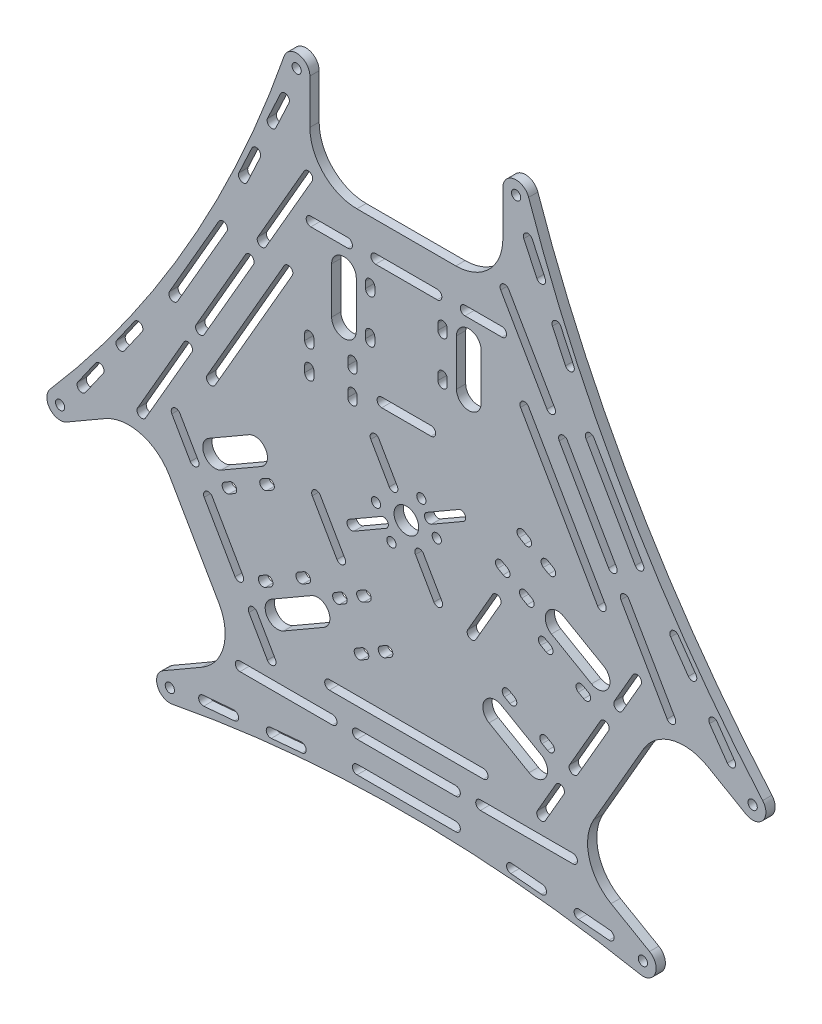
from build123d import *

# Parameters (mm, degrees)
SKETCH_1_R      = 1.5
SKETCH_1_R_2    = 4
EXTRUDE_1_DEPTH = 3


with BuildPart() as part:
    # 草图1 → 凸台-拉伸1 (new body)
    with BuildSketch(Plane.XY):
        with BuildLine():
            Line((16.05, 79.5), (-16.05, 79.5))
            ThreePointArc((-16.05, 79.5), (-26.833378413, 83.966621587), (-31.3, 94.75))
            Line((-31.3, 94.75), (-31.3, 109.16))
            ThreePointArc((-31.3, 109.16), (-34.888111661, 113.400662094), (-39.664286043, 110.564129253))
            ThreePointArc((-39.664286043, 110.564129253), (-71.327244812, 41.180803993), (-115.583487702, -20.93178529))
            ThreePointArc((-115.583487702, -20.93178529), (-115.651910009, -26.486340058), (-110.185333077, -27.473404862))
            Line((-110.185333077, -27.473404862), (-97.705907009, -20.268404862))
            ThreePointArc((-97.705907009, -20.268404862), (-86.133916571, -18.744923418), (-76.874019601, -25.850292269))
            Line((-76.874019601, -25.850292269), (-60.824019601, -53.649707731))
            ThreePointArc((-60.824019601, -53.649707731), (-59.300538158, -65.221698169), (-66.405907009, -74.481595138))
            Line((-66.405907009, -74.481595138), (-78.885333077, -81.686595138))
            ThreePointArc((-78.885333077, -81.686595138), (-80.763798349, -86.914322035), (-75.919201659, -89.632343963))
            ThreePointArc((-75.919201659, -89.632343963), (0, -82.361607985), (75.919201659, -89.632343963))
            ThreePointArc((75.919201659, -89.632343963), (80.763798349, -86.914322035), (78.885333077, -81.686595138))
            Line((78.885333077, -81.686595138), (66.405907009, -74.481595138))
            ThreePointArc((66.405907009, -74.481595138), (59.300538158, -65.221698169), (60.824019601, -53.649707731))
            Line((60.824019601, -53.649707731), (76.874019601, -25.850292269))
            ThreePointArc((76.874019601, -25.850292269), (86.133916571, -18.744923418), (97.705907009, -20.268404862))
            Line((97.705907009, -20.268404862), (110.185333077, -27.473404862))
            ThreePointArc((110.185333077, -27.473404862), (115.651910009, -26.486340058), (115.583487702, -20.93178529))
            ThreePointArc((115.583487702, -20.93178529), (71.327244812, 41.180803993), (39.664286043, 110.564129253))
            ThreePointArc((39.664286043, 110.564129253), (34.888111661, 113.400662094), (31.3, 109.16))
            Line((31.3, 109.16), (31.3, 94.75))
            ThreePointArc((31.3, 94.75), (26.833378413, 83.966621587), (16.05, 79.5))
        make_face()
        with BuildLine():
            Line((-66.008930265, -82.096499495), (-56.046998839, -81.224764293))
            ThreePointArc((-56.046998839, -81.224764293), (-54.421948845, -82.588293727), (-55.785478279, -84.213343721))
            Line((-55.785478279, -84.213343721), (-65.747409705, -85.085078923))
            ThreePointArc((-65.747409705, -85.085078923), (-67.372459699, -83.721549489), (-66.008930265, -82.096499495))
        make_face(mode=Mode.SUBTRACT)
        with BuildLine():
            Line((-44.092681128, -80.178682051), (-34.130749702, -79.30694685))
            ThreePointArc((-34.130749702, -79.30694685), (-32.505699707, -80.670476283), (-33.869229141, -82.295526278))
            Line((-33.869229141, -82.295526278), (-43.831160567, -83.167261479))
            ThreePointArc((-43.831160567, -83.167261479), (-45.456210561, -81.803732045), (-44.092681128, -80.178682051))
        make_face(mode=Mode.SUBTRACT)
        with BuildLine():
            Line((-53.999992654, -66.500012206), (-23.999992654, -66.500005425))
            ThreePointArc((-23.999992654, -66.500005425), (-22.499992315, -68.000005086), (-23.999991976, -69.500005425))
            Line((-23.999991976, -69.500005425), (-53.999991976, -69.500012206))
            ThreePointArc((-53.999991976, -69.500012206), (-55.499992315, -68.000012545), (-53.999992654, -66.500012206))
        make_face(mode=Mode.SUBTRACT)
        with BuildLine():
            Line((-45.087137249, -61.826787517), (-51.087137249, -51.434482672))
            ThreePointArc((-51.087137249, -51.434482672), (-50.538099143, -49.385444566), (-48.489061037, -49.934482672))
            Line((-48.489061037, -49.934482672), (-42.489061037, -60.326787517))
            ThreePointArc((-42.489061037, -60.326787517), (-43.038099143, -62.375825623), (-45.087137249, -61.826787517))
        make_face(mode=Mode.SUBTRACT)
        with BuildLine():
            Line((-44.041816248, -40.7273366), (-45.773867056, -41.7273366))
            ThreePointArc((-45.773867056, -41.7273366), (-47.822905162, -41.178298494), (-47.273867056, -39.129260389))
            Line((-47.273867056, -39.129260389), (-45.541816248, -38.129260389))
            ThreePointArc((-45.541816248, -38.129260389), (-43.492778143, -38.678298494), (-44.041816248, -40.7273366))
        make_face(mode=Mode.SUBTRACT)
        with BuildLine():
            Line((-26.811502154, -43.481116042), (-39.801883211, -50.981116042))
            ThreePointArc((-39.801883211, -50.981116042), (-45.265984826, -49.517014427), (-43.801883211, -44.052912811))
            Line((-43.801883211, -44.052912811), (-30.811502154, -36.552912811))
            ThreePointArc((-30.811502154, -36.552912811), (-25.347400539, -38.017014427), (-26.811502154, -43.481116042))
        make_face(mode=Mode.SUBTRACT)
        with BuildLine():
            Line((-12.944863729, -45.578838325), (-14.676914536, -46.578838325))
            ThreePointArc((-14.676914536, -46.578838325), (-16.725952642, -46.029800219), (-16.176914536, -43.980762114))
            Line((-16.176914536, -43.980762114), (-14.444863729, -42.980762114))
            ThreePointArc((-14.444863729, -42.980762114), (-12.395825623, -43.529800219), (-12.944863729, -45.578838325))
        make_face(mode=Mode.SUBTRACT)
        with BuildLine():
            Line((-5.150635095, -41.078838325), (-6.882685902, -42.078838325))
            ThreePointArc((-6.882685902, -42.078838325), (-8.931724008, -41.529800219), (-8.382685902, -39.480762114))
            Line((-8.382685902, -39.480762114), (-6.650635095, -38.480762114))
            ThreePointArc((-6.650635095, -38.480762114), (-4.601596989, -39.029800219), (-5.150635095, -41.078838325))
        make_face(mode=Mode.SUBTRACT)
        with BuildLine():
            Line((-62.989061037, -24.819745962), (-52.989061037, -42.140254038))
            ThreePointArc((-52.989061037, -42.140254038), (-53.538099143, -44.189292144), (-55.587137249, -43.640254038))
            Line((-55.587137249, -43.640254038), (-65.587137249, -26.319745962))
            ThreePointArc((-65.587137249, -26.319745962), (-65.038099143, -24.270707856), (-62.989061037, -24.819745962))
        make_face(mode=Mode.SUBTRACT)
        with BuildLine():
            ThreePointArc((-100.823632737, -6.20499228), (-98.734533526, -5.836665677), (-98.366206922, -7.925764888))
            Line((-98.366206922, -7.925764888), (-104.102115614, -16.117184269))
            ThreePointArc((-104.102115614, -16.117184269), (-106.191214825, -16.485510873), (-106.559541428, -14.396411662))
            Line((-106.559541428, -14.396411662), (-100.823632737, -6.20499228))
        make_face(mode=Mode.SUBTRACT)
        with BuildLine():
            ThreePointArc((-88.204633616, 11.816130359), (-86.115534405, 12.184456962), (-85.747207801, 10.095357751))
            Line((-85.747207801, 10.095357751), (-91.483116493, 1.90393837))
            ThreePointArc((-91.483116493, 1.90393837), (-93.572215704, 1.535611766), (-93.940542307, 3.624710977))
            Line((-93.940542307, 3.624710977), (-88.204633616, 11.816130359))
        make_face(mode=Mode.SUBTRACT)
        with BuildLine():
            Line((-73.489061037, -6.633212483), (-67.489061037, -17.025517328))
            ThreePointArc((-67.489061037, -17.025517328), (-68.038099143, -19.074555434), (-70.087137249, -18.525517328))
            Line((-70.087137249, -18.525517328), (-76.087137249, -8.133212483))
            ThreePointArc((-76.087137249, -8.133212483), (-75.538099143, -6.084174377), (-73.489061037, -6.633212483))
        make_face(mode=Mode.SUBTRACT)
        with BuildLine():
            ThreePointArc((-72.188769406, 13.965383654), (-70.1397313, 14.514421759), (-69.590693194, 12.465383654))
            Line((-69.590693194, 12.465383654), (-84.590693194, -13.51537846))
            ThreePointArc((-84.590693194, -13.51537846), (-86.6397313, -14.064416566), (-87.188769406, -12.01537846))
            Line((-87.188769406, -12.01537846), (-72.188769406, 13.965383654))
        make_face(mode=Mode.SUBTRACT)
        with BuildLine():
            Line((-31.839518309, -33.6823366), (-33.571569117, -34.6823366))
            ThreePointArc((-33.571569117, -34.6823366), (-35.620607222, -34.133298494), (-35.071569117, -32.084260389))
            Line((-35.071569117, -32.084260389), (-33.339518309, -31.084260389))
            ThreePointArc((-33.339518309, -31.084260389), (-31.290480203, -31.633298494), (-31.839518309, -33.6823366))
        make_face(mode=Mode.SUBTRACT)
        with BuildLine():
            Line((-55.791816248, -20.375739611), (-57.523867056, -21.375739611))
            ThreePointArc((-57.523867056, -21.375739611), (-59.572905162, -20.826701506), (-59.023867056, -18.7776634))
            Line((-59.023867056, -18.7776634), (-57.291816248, -17.7776634))
            ThreePointArc((-57.291816248, -17.7776634), (-55.242778143, -18.326701506), (-55.791816248, -20.375739611))
        make_face(mode=Mode.SUBTRACT)
        with BuildLine():
            Line((-19.944863729, -33.454482672), (-21.676914536, -34.454482672))
            ThreePointArc((-21.676914536, -34.454482672), (-23.725952642, -33.905444566), (-23.176914536, -31.856406461))
            Line((-23.176914536, -31.856406461), (-21.444863729, -30.856406461))
            ThreePointArc((-21.444863729, -30.856406461), (-19.395825623, -31.405444566), (-19.944863729, -33.454482672))
        make_face(mode=Mode.SUBTRACT)
        with BuildLine():
            Line((-12.150635095, -28.954482672), (-13.882685902, -29.954482672))
            ThreePointArc((-13.882685902, -29.954482672), (-15.931724008, -29.405444566), (-15.382685902, -27.356406461))
            Line((-15.382685902, -27.356406461), (-13.650635095, -26.356406461))
            ThreePointArc((-13.650635095, -26.356406461), (-11.601596989, -26.905444566), (-12.150635095, -28.954482672))
        make_face(mode=Mode.SUBTRACT)
        with BuildLine():
            Line((-27.928281907, -6.88679677), (-19.928281907, -20.74320323))
            ThreePointArc((-19.928281907, -20.74320323), (-20.477320012, -22.792241336), (-22.526358118, -22.24320323))
            Line((-22.526358118, -22.24320323), (-30.526358118, -8.38679677))
            ThreePointArc((-30.526358118, -8.38679677), (-29.977320012, -6.337758664), (-27.928281907, -6.88679677))
        make_face(mode=Mode.SUBTRACT)
        with BuildLine():
            Line((-47.061502154, -8.407087189), (-60.051883211, -15.907087189))
            ThreePointArc((-60.051883211, -15.907087189), (-65.515984826, -14.442985573), (-64.051883211, -8.978883958))
            Line((-64.051883211, -8.978883958), (-51.061502154, -1.478883958))
            ThreePointArc((-51.061502154, -1.478883958), (-45.597400539, -2.942985573), (-47.061502154, -8.407087189))
        make_face(mode=Mode.SUBTRACT)
        with BuildLine():
            Line((-43.589518309, -13.330739611), (-45.321569117, -14.330739611))
            ThreePointArc((-45.321569117, -14.330739611), (-47.370607222, -13.781701506), (-46.821569117, -11.7326634))
            Line((-46.821569117, -11.7326634), (-45.089518309, -10.7326634))
            ThreePointArc((-45.089518309, -10.7326634), (-43.040480203, -11.281701506), (-43.589518309, -13.330739611))
        make_face(mode=Mode.SUBTRACT)
        with BuildLine():
            ThreePointArc((-17.003520778, -11.549038106), (-19.052558883, -11), (-18.503520778, -8.950961894))
            Line((-18.503520778, -8.950961894), (-8.111215932, -2.950961894))
            ThreePointArc((-8.111215932, -2.950961894), (-6.062177826, -3.5), (-6.611215932, -5.549038106))
            Line((-6.611215932, -5.549038106), (-17.003520778, -11.549038106))
        make_face(mode=Mode.SUBTRACT)
        with Locations((-4.861215932, -8.580127019)):
            Circle(SKETCH_1_R, mode=Mode.SUBTRACT)
        with Locations((-9.861215932, 0.080127019)):
            Circle(SKETCH_1_R, mode=Mode.SUBTRACT)
        with BuildLine():
            ThreePointArc((-15.999992315, -79.5), (-17.499992315, -78), (-15.999992315, -76.5))
            Line((-15.999992315, -76.5), (16.000009945, -76.5))
            ThreePointArc((16.000009945, -76.5), (17.500009945, -78), (16.000009945, -79.5))
            Line((16.000009945, -79.5), (-15.999992315, -79.5))
        make_face(mode=Mode.SUBTRACT)
        with BuildLine():
            ThreePointArc((-15.999992315, -69.5), (-17.499992315, -68), (-15.999992315, -66.5))
            Line((-15.999992315, -66.5), (16.000007685, -66.5))
            ThreePointArc((16.000007685, -66.5), (17.500007685, -68), (16.000007685, -69.5))
            Line((16.000007685, -69.5), (-15.999992315, -69.5))
        make_face(mode=Mode.SUBTRACT)
        with BuildLine():
            ThreePointArc((33.869247743, -82.295518622), (32.505717942, -80.670468936), (34.130767628, -79.306939135))
            Line((34.130767628, -79.306939135), (44.092699251, -80.178672085))
            ThreePointArc((44.092699251, -80.178672085), (45.456229052, -81.803721771), (43.831179366, -83.167251572))
            Line((43.831179366, -83.167251572), (33.869247743, -82.295518622))
        make_face(mode=Mode.SUBTRACT)
        with BuildLine():
            ThreePointArc((24.000007685, -69.5), (22.500007685, -68), (24.000007685, -66.5))
            Line((24.000007685, -66.5), (54.000007685, -66.5))
            ThreePointArc((54.000007685, -66.5), (55.500007685, -68), (54.000007685, -69.5))
            Line((54.000007685, -69.5), (24.000007685, -69.5))
        make_face(mode=Mode.SUBTRACT)
        with BuildLine():
            ThreePointArc((-24.999993366, -60.2), (-26.499993366, -58.7), (-24.999993366, -57.2))
            Line((-24.999993366, -57.2), (25.000006634, -57.2))
            ThreePointArc((25.000006634, -57.2), (26.500006634, -58.7), (25.000006634, -60.2))
            Line((25.000006634, -60.2), (-24.999993366, -60.2))
        make_face(mode=Mode.SUBTRACT)
        with BuildLine():
            Line((42.489061037, -60.326787517), (48.489061037, -49.934482672))
            ThreePointArc((48.489061037, -49.934482672), (50.538099143, -49.385444566), (51.087137249, -51.434482672))
            Line((51.087137249, -51.434482672), (45.087137249, -61.826787517))
            ThreePointArc((45.087137249, -61.826787517), (43.038099143, -62.375825623), (42.489061037, -60.326787517))
        make_face(mode=Mode.SUBTRACT)
        with BuildLine():
            Line((30.811502154, -36.552912811), (43.801883211, -44.052912811))
            ThreePointArc((43.801883211, -44.052912811), (45.265984826, -49.517014427), (39.801883211, -50.981116042))
            Line((39.801883211, -50.981116042), (26.811502154, -43.481116042))
            ThreePointArc((26.811502154, -43.481116042), (25.347400539, -38.017014427), (30.811502154, -36.552912811))
        make_face(mode=Mode.SUBTRACT)
        with BuildLine():
            Line((45.541816248, -38.129260389), (47.273867056, -39.129260389))
            ThreePointArc((47.273867056, -39.129260389), (47.822905162, -41.178298494), (45.773867056, -41.7273366))
            Line((45.773867056, -41.7273366), (44.041816248, -40.7273366))
            ThreePointArc((44.041816248, -40.7273366), (43.492778143, -38.678298494), (45.541816248, -38.129260389))
        make_face(mode=Mode.SUBTRACT)
        with BuildLine():
            ThreePointArc((55.785497314, -84.213331112), (54.421967513, -82.588281426), (56.047017199, -81.224751625))
            Line((56.047017199, -81.224751625), (66.008948822, -82.096484575))
            ThreePointArc((66.008948822, -82.096484575), (67.372478623, -83.72153426), (65.747428937, -85.085064061))
            Line((65.747428937, -85.085064061), (55.785497314, -84.213331112))
        make_face(mode=Mode.SUBTRACT)
        with BuildLine():
            Line((19.928281907, -20.74320323), (27.928281907, -6.88679677))
            ThreePointArc((27.928281907, -6.88679677), (29.977320012, -6.337758664), (30.526358118, -8.38679677))
            Line((30.526358118, -8.38679677), (22.526358118, -22.24320323))
            ThreePointArc((22.526358118, -22.24320323), (20.477320012, -22.792241336), (19.928281907, -20.74320323))
        make_face(mode=Mode.SUBTRACT)
        with BuildLine():
            Line((33.339518309, -31.084260389), (35.071569117, -32.084260389))
            ThreePointArc((35.071569117, -32.084260389), (35.620607222, -34.133298494), (33.571569117, -34.6823366))
            Line((33.571569117, -34.6823366), (31.839518309, -33.6823366))
            ThreePointArc((31.839518309, -33.6823366), (31.290480203, -31.633298494), (33.339518309, -31.084260389))
        make_face(mode=Mode.SUBTRACT)
        with BuildLine():
            Line((57.291816248, -17.7776634), (59.023867056, -18.7776634))
            ThreePointArc((59.023867056, -18.7776634), (59.572905162, -20.826701506), (57.523867056, -21.375739611))
            Line((57.523867056, -21.375739611), (55.791816248, -20.375739611))
            ThreePointArc((55.791816248, -20.375739611), (55.242778143, -18.326701506), (57.291816248, -17.7776634))
        make_face(mode=Mode.SUBTRACT)
        with BuildLine():
            ThreePointArc((11.549038106, -17.003520778), (11, -19.052558883), (8.950961894, -18.503520778))
            Line((8.950961894, -18.503520778), (2.950961894, -8.111215932))
            ThreePointArc((2.950961894, -8.111215932), (3.5, -6.062177826), (5.549038106, -6.611215932))
            Line((5.549038106, -6.611215932), (11.549038106, -17.003520778))
        make_face(mode=Mode.SUBTRACT)
        Circle(SKETCH_1_R_2, mode=Mode.SUBTRACT)
        with Locations((9.861215932, -0.080127019)):
            Circle(SKETCH_1_R, mode=Mode.SUBTRACT)
        with Locations((4.861215932, 8.580127019)):
            Circle(SKETCH_1_R, mode=Mode.SUBTRACT)
        with BuildLine():
            ThreePointArc((17.003520778, 11.549038106), (19.052558883, 11), (18.503520778, 8.950961894))
            Line((18.503520778, 8.950961894), (8.111215932, 2.950961894))
            ThreePointArc((8.111215932, 2.950961894), (6.062177826, 3.5), (6.611215932, 5.549038106))
            Line((6.611215932, 5.549038106), (17.003520778, 11.549038106))
        make_face(mode=Mode.SUBTRACT)
        with BuildLine():
            Line((38.944863729, -0.545517328), (40.676914536, -1.545517328))
            ThreePointArc((40.676914536, -1.545517328), (41.225952642, -3.594555434), (39.176914536, -4.143593539))
            Line((39.176914536, -4.143593539), (37.444863729, -3.143593539))
            ThreePointArc((37.444863729, -3.143593539), (36.895825623, -1.094555434), (38.944863729, -0.545517328))
        make_face(mode=Mode.SUBTRACT)
        with BuildLine():
            Line((45.089518309, -10.7326634), (46.821569117, -11.7326634))
            ThreePointArc((46.821569117, -11.7326634), (47.370607222, -13.781701506), (45.321569117, -14.330739611))
            Line((45.321569117, -14.330739611), (43.589518309, -13.330739611))
            ThreePointArc((43.589518309, -13.330739611), (43.040480203, -11.281701506), (45.089518309, -10.7326634))
        make_face(mode=Mode.SUBTRACT)
        with BuildLine():
            Line((51.061502154, -1.478883958), (64.051883211, -8.978883958))
            ThreePointArc((64.051883211, -8.978883958), (65.515984826, -14.442985573), (60.051883211, -15.907087189))
            Line((60.051883211, -15.907087189), (47.061502154, -8.407087189))
            ThreePointArc((47.061502154, -8.407087189), (45.597400539, -2.942985573), (51.061502154, -1.478883958))
        make_face(mode=Mode.SUBTRACT)
        with BuildLine():
            Line((31.150635095, 3.954482672), (32.882685902, 2.954482672))
            ThreePointArc((32.882685902, 2.954482672), (33.431724008, 0.905444566), (31.382685902, 0.356406461))
            Line((31.382685902, 0.356406461), (29.650635095, 1.356406461))
            ThreePointArc((29.650635095, 1.356406461), (29.101596989, 3.405444566), (31.150635095, 3.954482672))
        make_face(mode=Mode.SUBTRACT)
        with BuildLine():
            Line((45.944863729, 11.578838325), (47.676914536, 10.578838325))
            ThreePointArc((47.676914536, 10.578838325), (48.225952642, 8.529800219), (46.176914536, 7.980762114))
            Line((46.176914536, 7.980762114), (44.444863729, 8.980762114))
            ThreePointArc((44.444863729, 8.980762114), (43.895825623, 11.029800219), (45.944863729, 11.578838325))
        make_face(mode=Mode.SUBTRACT)
        with BuildLine():
            Line((52.989061037, -42.140254038), (62.989061037, -24.819745962))
            ThreePointArc((62.989061037, -24.819745962), (65.038099143, -24.270707856), (65.587137249, -26.319745962))
            Line((65.587137249, -26.319745962), (55.587137249, -43.640254038))
            ThreePointArc((55.587137249, -43.640254038), (53.538099143, -44.189292144), (52.989061037, -42.140254038))
        make_face(mode=Mode.SUBTRACT)
        with BuildLine():
            Line((76.087137249, -8.133212483), (70.087137249, -18.525517328))
            ThreePointArc((70.087137249, -18.525517328), (68.038099143, -19.074555434), (67.489061037, -17.025517328))
            Line((67.489061037, -17.025517328), (73.489061037, -6.633212483))
            ThreePointArc((73.489061037, -6.633212483), (75.538099143, -6.084174377), (76.087137249, -8.133212483))
        make_face(mode=Mode.SUBTRACT)
        with BuildLine():
            Line((84.590696249, -13.51535934), (69.590690377, 12.465399383))
            ThreePointArc((69.590690377, 12.465399383), (70.139728019, 14.514437613), (72.188766249, 13.965399971))
            Line((72.188766249, 13.965399971), (87.188772121, -12.015358752))
            ThreePointArc((87.188772121, -12.015358752), (86.639734479, -14.064396982), (84.590696249, -13.51535934))
        make_face(mode=Mode.SUBTRACT)
        with BuildLine():
            Line((104.102119257, -16.117160739), (98.366208714, -7.925742654))
            ThreePointArc((98.366208714, -7.925742654), (98.734534845, -5.83664336), (100.823634139, -6.204969491))
            Line((100.823634139, -6.204969491), (106.559544682, -14.396387576))
            ThreePointArc((106.559544682, -14.396387576), (106.191218551, -16.48548687), (104.102119257, -16.117160739))
        make_face(mode=Mode.SUBTRACT)
        with BuildLine():
            Line((91.483029166, 1.903909493), (85.747264802, 10.095429936))
            ThreePointArc((85.747264802, 10.095429936), (86.115628214, 12.184522657), (88.204720935, 11.816159245))
            Line((88.204720935, 11.816159245), (93.940485299, 3.624638803))
            ThreePointArc((93.940485299, 3.624638803), (93.572121887, 1.535546082), (91.483029166, 1.903909493))
        make_face(mode=Mode.SUBTRACT)
        with BuildLine():
            ThreePointArc((-52.188769406, 48.606399805), (-50.1397313, 49.155437911), (-49.590693194, 47.106399805))
            Line((-49.590693194, 47.106399805), (-65.590693194, 19.393586884))
            ThreePointArc((-65.590693194, 19.393586884), (-67.6397313, 18.844548778), (-68.188769406, 20.893586884))
            Line((-68.188769406, 20.893586884), (-52.188769406, 48.606399805))
        make_face(mode=Mode.SUBTRACT)
        with BuildLine():
            ThreePointArc((-60.849023443, 53.606399805), (-58.799985338, 54.155437911), (-58.250947232, 52.106399805))
            Line((-58.250947232, 52.106399805), (-74.250948362, 24.393584926))
            ThreePointArc((-74.250948362, 24.393584926), (-76.299986468, 23.844546821), (-76.849024574, 25.893584926))
            Line((-76.849024574, 25.893584926), (-60.849023443, 53.606399805))
        make_face(mode=Mode.SUBTRACT)
        with BuildLine():
            ThreePointArc((-39.634732625, 51.750629349), (-37.585694519, 52.299667455), (-37.036656414, 50.250629349))
            Line((-37.036656414, 50.250629349), (-62.036656414, 6.94935916))
            ThreePointArc((-62.036656414, 6.94935916), (-64.085694519, 6.400321054), (-64.634732625, 8.44935916))
            Line((-64.634732625, 8.44935916), (-39.634732625, 51.750629349))
        make_face(mode=Mode.SUBTRACT)
        with BuildLine():
            ThreePointArc((-33, 27), (-31.5, 28.5), (-30, 27))
            Line((-30, 27), (-30, 25))
            ThreePointArc((-30, 25), (-31.5, 23.5), (-33, 25))
            Line((-33, 25), (-33, 27))
        make_face(mode=Mode.SUBTRACT)
        with BuildLine():
            ThreePointArc((-33, 36), (-31.5, 37.5), (-30, 36))
            Line((-30, 36), (-30, 34))
            ThreePointArc((-30, 34), (-31.5, 32.5), (-33, 34))
            Line((-33, 34), (-33, 36))
        make_face(mode=Mode.SUBTRACT)
        with BuildLine():
            ThreePointArc((-11.549038106, 17.003520778), (-11, 19.052558883), (-8.950961894, 18.503520778))
            Line((-8.950961894, 18.503520778), (-2.950961894, 8.111215932))
            ThreePointArc((-2.950961894, 8.111215932), (-3.5, 6.062177826), (-5.549038106, 6.611215932))
            Line((-5.549038106, 6.611215932), (-11.549038106, 17.003520778))
        make_face(mode=Mode.SUBTRACT)
        with BuildLine():
            ThreePointArc((-19, 27), (-17.5, 28.5), (-16, 27))
            Line((-16, 27), (-16, 25))
            ThreePointArc((-16, 25), (-17.5, 23.5), (-19, 25))
            Line((-19, 25), (-19, 27))
        make_face(mode=Mode.SUBTRACT)
        with BuildLine():
            ThreePointArc((-19, 36), (-17.5, 37.5), (-16, 36))
            Line((-16, 36), (-16, 34))
            ThreePointArc((-16, 34), (-17.5, 32.5), (-19, 34))
            Line((-19, 34), (-19, 36))
        make_face(mode=Mode.SUBTRACT)
        with BuildLine():
            Line((-13.25, 44.415), (-13.25, 46.415))
            ThreePointArc((-13.25, 46.415), (-11.75, 47.915), (-10.25, 46.415))
            Line((-10.25, 46.415), (-10.25, 44.415))
            ThreePointArc((-10.25, 44.415), (-11.75, 42.915), (-13.25, 44.415))
        make_face(mode=Mode.SUBTRACT)
        with BuildLine():
            Line((-24.25, 44.96), (-24.25, 59.96))
            ThreePointArc((-24.25, 59.96), (-20.25, 63.96), (-16.25, 59.96))
            Line((-16.25, 59.96), (-16.25, 44.96))
            ThreePointArc((-16.25, 44.96), (-20.25, 40.96), (-24.25, 44.96))
        make_face(mode=Mode.SUBTRACT)
        with BuildLine():
            Line((-13.25, 58.505), (-13.25, 60.505))
            ThreePointArc((-13.25, 60.505), (-11.75, 62.005), (-10.25, 60.505))
            Line((-10.25, 60.505), (-10.25, 58.505))
            ThreePointArc((-10.25, 58.505), (-11.75, 57.005), (-13.25, 58.505))
        make_face(mode=Mode.SUBTRACT)
        with BuildLine():
            Line((-47.390348571, 78.274672526), (-51.616531188, 69.211594656))
            ThreePointArc((-51.616531188, 69.211594656), (-53.609920261, 68.486060368), (-54.335454549, 70.479449441))
            Line((-54.335454549, 70.479449441), (-50.109271932, 79.542527311))
            ThreePointArc((-50.109271932, 79.542527311), (-48.115882859, 80.268061599), (-47.390348571, 78.274672526))
        make_face(mode=Mode.SUBTRACT)
        with BuildLine():
            Line((-30.590703595, 80.015371545), (-45.590697723, 54.034606041))
            ThreePointArc((-45.590697723, 54.034606041), (-47.639735704, 53.485567473), (-48.188774273, 55.534605454))
            Line((-48.188774273, 55.534605454), (-33.188780146, 81.515370958))
            ThreePointArc((-33.188780146, 81.515370958), (-31.139742164, 82.064409527), (-30.590703595, 80.015371545))
        make_face(mode=Mode.SUBTRACT)
        with BuildLine():
            Line((-31, 69.96), (-19, 69.96))
            ThreePointArc((-19, 69.96), (-17.5, 68.46), (-19, 66.96))
            Line((-19, 66.96), (-31, 66.96))
            ThreePointArc((-31, 66.96), (-32.5, 68.46), (-31, 69.96))
        make_face(mode=Mode.SUBTRACT)
        with BuildLine():
            Line((-38.093188992, 98.213660234), (-42.319209875, 89.150506947))
            ThreePointArc((-42.319209875, 89.150506947), (-44.312586, 88.424937087), (-45.038155861, 90.418313212))
            Line((-45.038155861, 90.418313212), (-40.812134978, 99.481466499))
            ThreePointArc((-40.812134978, 99.481466499), (-38.818758852, 100.207036359), (-38.093188992, 98.213660234))
        make_face(mode=Mode.SUBTRACT)
        with BuildLine():
            ThreePointArc((-8, 27.63), (-9.5, 29.13), (-8, 30.63))
            Line((-8, 30.63), (8, 30.63))
            ThreePointArc((8, 30.63), (9.5, 29.13), (8, 27.63))
            Line((8, 27.63), (-8, 27.63))
        make_face(mode=Mode.SUBTRACT)
        with BuildLine():
            Line((38.150635095, 16.078838325), (39.882685902, 15.078838325))
            ThreePointArc((39.882685902, 15.078838325), (40.431724008, 13.029800219), (38.382685902, 12.480762114))
            Line((38.382685902, 12.480762114), (36.650635095, 13.480762114))
            ThreePointArc((36.650635095, 13.480762114), (36.101596989, 15.529800219), (38.150635095, 16.078838325))
        make_face(mode=Mode.SUBTRACT)
        with BuildLine():
            ThreePointArc((64.634725991, 8.449370651), (64.085687885, 6.400332545), (62.036649779, 6.949370651))
            Line((62.036649779, 6.949370651), (37.036649779, 50.25064084))
            ThreePointArc((37.036649779, 50.25064084), (37.585687885, 52.299678946), (39.634725991, 51.75064084))
            Line((39.634725991, 51.75064084), (64.634725991, 8.449370651))
        make_face(mode=Mode.SUBTRACT)
        with BuildLine():
            ThreePointArc((10.25, 46.415), (11.75, 47.915), (13.25, 46.415))
            Line((13.25, 46.415), (13.25, 44.415))
            ThreePointArc((13.25, 44.415), (11.75, 42.915), (10.25, 44.415))
            Line((10.25, 44.415), (10.25, 46.415))
        make_face(mode=Mode.SUBTRACT)
        with BuildLine():
            ThreePointArc((10.25, 60.505), (11.75, 62.005), (13.25, 60.505))
            Line((13.25, 60.505), (13.25, 58.505))
            ThreePointArc((13.25, 58.505), (11.75, 57.005), (10.25, 58.505))
            Line((10.25, 58.505), (10.25, 60.505))
        make_face(mode=Mode.SUBTRACT)
        with BuildLine():
            ThreePointArc((16.25, 59.96), (20.25, 63.96), (24.25, 59.96))
            Line((24.25, 59.96), (24.25, 44.96))
            ThreePointArc((24.25, 44.96), (20.25, 40.96), (16.25, 44.96))
            Line((16.25, 44.96), (16.25, 59.96))
        make_face(mode=Mode.SUBTRACT)
        with BuildLine():
            ThreePointArc((68.18876172, 20.893600195), (67.639723615, 18.844562089), (65.590685509, 19.393600195))
            Line((65.590685509, 19.393600195), (49.590685509, 47.106413116))
            ThreePointArc((49.590685509, 47.106413116), (50.139723615, 49.155451222), (52.18876172, 48.606413116))
            Line((52.18876172, 48.606413116), (68.18876172, 20.893600195))
        make_face(mode=Mode.SUBTRACT)
        with BuildLine():
            ThreePointArc((76.849015758, 25.893600195), (76.299977653, 23.844562089), (74.250939547, 24.393600195))
            Line((74.250939547, 24.393600195), (58.250938417, 52.106415074))
            ThreePointArc((58.250938417, 52.106415074), (58.799976522, 54.155453179), (60.849014628, 53.606415074))
            Line((60.849014628, 53.606415074), (76.849015758, 25.893600195))
        make_face(mode=Mode.SUBTRACT)
        with BuildLine():
            ThreePointArc((-10, 66.96), (-11.5, 68.46), (-10, 69.96))
            Line((-10, 69.96), (10, 69.96))
            ThreePointArc((10, 69.96), (11.5, 68.46), (10, 66.96))
            Line((10, 66.96), (-10, 66.96))
        make_face(mode=Mode.SUBTRACT)
        with BuildLine():
            ThreePointArc((19, 66.96), (17.5, 68.46), (19, 69.96))
            Line((19, 69.96), (31, 69.96))
            ThreePointArc((31, 69.96), (32.5, 68.46), (31, 66.96))
            Line((31, 66.96), (19, 66.96))
        make_face(mode=Mode.SUBTRACT)
        with BuildLine():
            ThreePointArc((48.18876172, 55.534616346), (47.639723615, 53.485578241), (45.590685509, 54.034616346))
            Line((45.590685509, 54.034616346), (30.590685509, 80.01537846))
            ThreePointArc((30.590685509, 80.01537846), (31.139723615, 82.064416566), (33.18876172, 81.51537846))
            Line((33.18876172, 81.51537846), (48.18876172, 55.534616346))
        make_face(mode=Mode.SUBTRACT)
        with BuildLine():
            ThreePointArc((54.335385873, 70.479388263), (53.609816463, 68.486011974), (51.616440174, 69.211581384))
            Line((51.616440174, 69.211581384), (47.390417242, 78.274733715))
            ThreePointArc((47.390417242, 78.274733715), (48.115986652, 80.268110004), (50.109362941, 79.542540595))
            Line((50.109362941, 79.542540595), (54.335385873, 70.479388263))
        make_face(mode=Mode.SUBTRACT)
        with BuildLine():
            ThreePointArc((45.038135423, 90.418323392), (44.312566013, 88.424947103), (42.319189724, 89.150516513))
            Line((42.319189724, 89.150516513), (38.093166792, 98.213668844))
            ThreePointArc((38.093166792, 98.213668844), (38.818736202, 100.207045133), (40.812112492, 99.481475723))
            Line((40.812112492, 99.481475723), (45.038135423, 90.418323392))
        make_face(mode=Mode.SUBTRACT)
        with Locations(Location((-35.6, 109.16, 0), (0, 0, 180))):
            Circle(SKETCH_1_R, mode=Mode.SUBTRACT)
        with Locations((35.6, 109.16)):
            Circle(SKETCH_1_R, mode=Mode.SUBTRACT)
        with Locations((-112.335333077, -23.749495625)):
            Circle(SKETCH_1_R, mode=Mode.SUBTRACT)
        with Locations((112.335333077, -23.749495625)):
            Circle(SKETCH_1_R, mode=Mode.SUBTRACT)
        with Locations((-76.735333077, -85.410504375)):
            Circle(SKETCH_1_R, mode=Mode.SUBTRACT)
        with Locations((76.735333077, -85.410504375)):
            Circle(SKETCH_1_R, mode=Mode.SUBTRACT)
    extrude(amount=EXTRUDE_1_DEPTH)


solid = part.part
